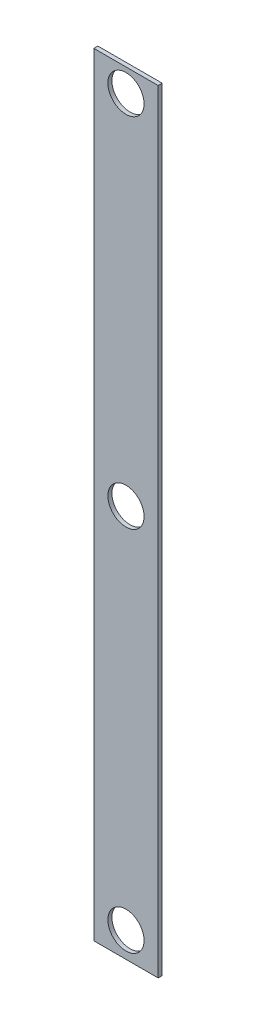
from build123d import *

# Parameters (mm, degrees)
SKETCH1_W           = 50.8
SKETCH1_H           = 609.6
BOSS_EXTRUDE1_DEPTH = 3.175
SKETCH2_R           = 14.279
CUT_EXTRUDE1_DEPTH  = 612.721244216


with BuildPart() as part:
    # Sketch1 → Boss-Extrude1 (new body)
    with BuildSketch(Plane.XY):
        with Locations((25.4, -304.8)):
            Rectangle(SKETCH1_W, SKETCH1_H)
    extrude(amount=BOSS_EXTRUDE1_DEPTH)

    # Sketch2 → Cut-Extrude1 (cut, through all)
    with BuildSketch(Plane.XY.offset(3.175)):
        with Locations((25.4, -18.141364063)):
            Circle(SKETCH2_R)
        with Locations((25.4, -589.6)):
            Circle(SKETCH2_R)
        with Locations((25.4, -300)):
            Circle(SKETCH2_R)
    extrude(amount=-CUT_EXTRUDE1_DEPTH, mode=Mode.SUBTRACT)


solid = part.part
